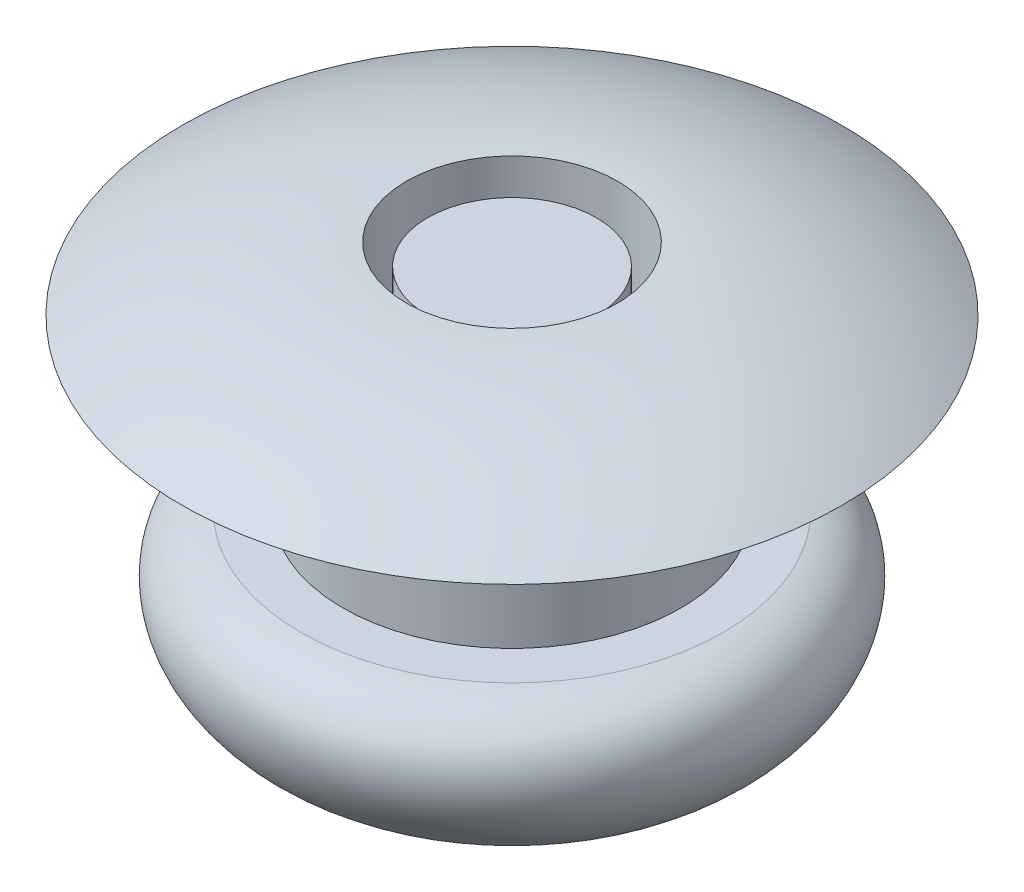
from build123d import *


with BuildPart() as part:
    # Szkic1 → Obrót1 (revolve)
    with BuildSketch(Plane.XY):
        with BuildLine():
            Line((-3.9, 4), (-2, 4))
            Line((-2, 4), (-2, 2))
            Line((-2, 2), (-2.5, 2))
            add(Edge.make_bspline(
                [(-2.5, 2), (-3.327610974, 1.852247073), (-3.254907827, 0.034566899), (-0.030071268, -0.376789975), (-1.228998971, 1.675004369), (-0.216890965, 0.508770592), (0, 0.578476955)],
                knots=[0, 0, 0, 0, 0.343812162, 0.687238794, 0.81979877, 1, 1, 1, 1], degree=3))
            Line((0, 0.578476955), (0, 4.5))
            Line((0, 4.5), (-1, 4.5))
            Line((-1, 4.5), (-1, 2))
            Line((-1, 2), (-1.25, 2))
            Line((-1.25, 2), (-1.25, 4.75))
            ThreePointArc((-1.25, 4.75), (-2.627043935, 4.558888572), (-3.9, 4))
        make_face()
    revolve(axis=Axis((0, 4.5, 0), (0, -1, 0)))


solid = part.part
